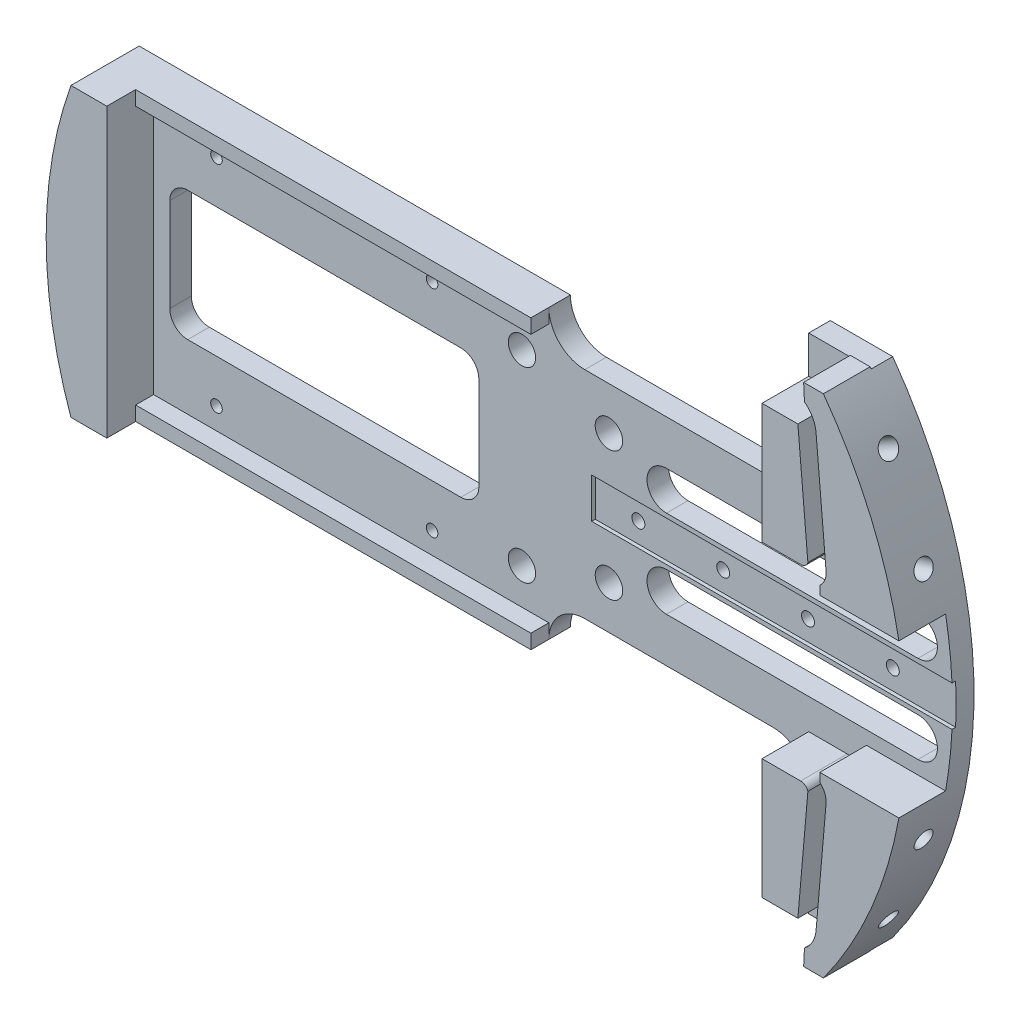
from build123d import *

# Parameters (mm, degrees)
BOSS_EXTRUDE1_DEPTH     = 3.81
BOSS_EXTRUDE2_DEPTH     = 8.255
SKETCH3_W               = 64.77
SKETCH3_H               = 7.1
CUT_EXTRUDE1_DEPTH      = 0.635
CUT_EXTRUDE4_DEPTH      = 89.512075769
CUT_EXTRUDE5_DEPTH      = 89.512075769
SKETCH12_R              = 2.4257
CUT_EXTRUDE6_DEPTH      = 89.512075769
SKETCH4_R               = 1.143
CUT_EXTRUDE2_DEPTH      = 11.43
SKETCH17_R              = 2.413
CUT_EXTRUDE9_DEPTH      = 89.512075769
BOSS_EXTRUDE5_DEPTH     = 8.255
SKETCH20_W              = 69.85
SKETCH20_H              = 3.175
BOSS_EXTRUDE6_DEPTH     = 2.54
SKETCH21_R              = 1.02235
CUT_EXTRUDE10_DEPTH     = 89.948337573
SKETCH24_R              = 1.6383
CUT_EXTRUDE11_DEPTH     = 8.128
CIRPATTERN1_COUNT       = 2
CIRPATTERN1_ANGLE       = 12.5
MIRROR2_COPY_1_SKETCH_R = 1.6383
MIRROR2_COPY_1_DEPTH    = 8.128
MIRROR2_COPY_2_SKETCH_R = 1.6383
MIRROR2_COPY_2_DEPTH    = 8.128


with BuildPart() as part:
    # Sketch1 → Boss-Extrude1 (new body)
    with BuildSketch(Plane.XY):
        with BuildLine():
            Line((10.977415053, 19.05), (44.196, 19.05))
            ThreePointArc((44.196, 19.05), (48.686128061, 20.909871939), (50.546, 25.4))
            Line((50.546, 25.4), (50.546, 44.45))
            Line((50.546, 44.45), (61.579155694, 44.45))
            ThreePointArc((61.579155694, 44.45), (75.946, 0), (61.579155694, -44.45))
            Line((61.579155694, -44.45), (50.546, -44.45))
            Line((50.546, -44.45), (50.546, -25.4))
            ThreePointArc((50.546, -25.4), (48.686128061, -20.909871939), (44.196, -19.05))
            Line((44.196, -19.05), (10.977415053, -19.05))
            ThreePointArc((10.977415053, -19.05), (6.487286992, -20.909871939), (4.627415053, -25.4))
            Line((4.627415053, -25.4), (-71.572584947, -25.4))
            ThreePointArc((-71.572584947, -25.4), (-75.946, 0), (-71.572584947, 25.4))
            Line((-71.572584947, 25.4), (4.627415053, 25.4))
            ThreePointArc((4.627415053, 25.4), (6.487286992, 20.909871939), (10.977415053, 19.05))
        make_face()
    extrude(amount=BOSS_EXTRUDE1_DEPTH)

    # Sketch2 → Boss-Extrude2 (add)
    with BuildSketch(Plane.XY.offset(3.81)):
        with BuildLine():
            Line((61.865268471, 17.78), (60.095110466, 38.1))
            ThreePointArc((60.095110466, 38.1), (59.464196764, 40.158289632), (58.047089349, 41.778911391))
            Line((58.047089349, 41.778911391), (57.900800643, 44.704))
            Line((57.900800643, 44.704), (61.395010384, 44.704))
            ThreePointArc((61.395010384, 44.704), (69.822038137, 29.877715884), (74.728381149, 13.544887112))
            Line((74.728381149, 13.544887112), (60.759450402, 13.544887112))
            Line((60.759450402, 13.544887112), (60.759450402, 15.094127876))
            ThreePointArc((60.759450402, 15.094127876), (61.639191639, 16.302501703), (61.865268471, 17.78))
        make_face()
        with BuildLine():
            Line((58.651639318, 17.500047669), (56.881481313, 37.820047669))
            Line((56.881481313, 37.820047669), (50.546, 37.820047669))
            Line((50.546, 37.820047669), (50.546, 16.566735288))
            Line((50.546, 16.566735288), (57.366094516, 16.566735288))
            ThreePointArc((57.366094516, 16.566735288), (58.160401987, 16.824667019), (58.651639318, 17.500047669))
        make_face()
        with BuildLine():
            Line((60.759450402, -13.544887112), (74.728381149, -13.544887112))
            ThreePointArc((74.728381149, -13.544887112), (69.822038137, -29.877715884), (61.395010384, -44.704))
            Line((61.395010384, -44.704), (57.900800643, -44.704))
            Line((57.900800643, -44.704), (58.047089349, -41.778911391))
            ThreePointArc((58.047089349, -41.778911391), (59.464196764, -40.158289632), (60.095110466, -38.1))
            Line((60.095110466, -38.1), (61.865268471, -17.78))
            ThreePointArc((61.865268471, -17.78), (61.639191639, -16.302501703), (60.759450402, -15.094127876))
            Line((60.759450402, -15.094127876), (60.759450402, -13.544887112))
        make_face()
        with BuildLine():
            Line((50.546, -16.566735288), (57.366094516, -16.566735288))
            ThreePointArc((57.366094516, -16.566735288), (58.160401987, -16.824667019), (58.651639318, -17.500047669))
            Line((58.651639318, -17.500047669), (56.881481313, -37.820047669))
            Line((56.881481313, -37.820047669), (50.546, -37.820047669))
            Line((50.546, -37.820047669), (50.546, -16.566735288))
        make_face()
    extrude(amount=BOSS_EXTRUDE2_DEPTH)

    # Sketch3 → Cut-Extrude1 (cut)
    with BuildSketch(Plane.XY.offset(3.81)):
        with Locations((44.577, 0)):
            Rectangle(SKETCH3_W, SKETCH3_H)
    extrude(amount=-CUT_EXTRUDE1_DEPTH, mode=Mode.SUBTRACT)

    # Sketch9 → Cut-Extrude4 (cut, through all)
    with BuildSketch(Plane.XY.offset(3.81)):
        with BuildLine():
            Line((69.85, 11.17), (25.4, 11.17))
            ThreePointArc((25.4, 11.17), (21.971, 7.741), (25.4, 4.312))
            Line((25.4, 4.312), (69.85, 4.312))
            ThreePointArc((69.85, 4.312), (73.279, 7.741), (69.85, 11.17))
        make_face()
        with BuildLine():
            Line((69.85, -4.312), (25.4, -4.312))
            ThreePointArc((25.4, -4.312), (21.971, -7.741), (25.4, -11.17))
            Line((25.4, -11.17), (69.85, -11.17))
            ThreePointArc((69.85, -11.17), (73.279, -7.741), (69.85, -4.312))
        make_face()
    extrude(amount=-CUT_EXTRUDE4_DEPTH, mode=Mode.SUBTRACT)

    # Sketch10 → Cut-Extrude5 (cut, through all)
    with BuildSketch(Plane.XY.offset(3.81)):
        with BuildLine():
            Line((-10.922, 11.43), (-59.182, 11.43))
            ThreePointArc((-59.182, 11.43), (-61.42706403, 10.50006403), (-62.357, 8.255))
            Line((-62.357, 8.255), (-62.357, -8.255))
            ThreePointArc((-62.357, -8.255), (-61.42706403, -10.50006403), (-59.182, -11.43))
            Line((-59.182, -11.43), (-10.922, -11.43))
            ThreePointArc((-10.922, -11.43), (-8.67693597, -10.50006403), (-7.747, -8.255))
            Line((-7.747, -8.255), (-7.747, 8.255))
            ThreePointArc((-7.747, 8.255), (-8.67693597, 10.50006403), (-10.922, 11.43))
        make_face()
    extrude(amount=-CUT_EXTRUDE5_DEPTH, mode=Mode.SUBTRACT)

    # Sketch12 → Cut-Extrude6 (cut, through all)
    with BuildSketch(Plane.XY.offset(3.81)):
        with Locations((15.24, 11.43)):
            Circle(SKETCH12_R)
        with Locations((15.24, -11.43)):
            Circle(SKETCH12_R)
    extrude(amount=-CUT_EXTRUDE6_DEPTH, mode=Mode.SUBTRACT)

    # Sketch4 → Cut-Extrude2 (cut)
    with BuildSketch(Plane.XY.offset(3.175)):
        with Locations((19.812, 0)):
            Circle(SKETCH4_R)
        with Locations((34.798, 0)):
            Circle(SKETCH4_R)
        with Locations((49.784, 0)):
            Circle(SKETCH4_R)
        with Locations((64.77, 0)):
            Circle(SKETCH4_R)
    extrude(amount=-CUT_EXTRUDE2_DEPTH, mode=Mode.SUBTRACT)

    # Sketch17 → Cut-Extrude9 (cut, through all)
    with BuildSketch(Plane.XY.offset(3.81)):
        with Locations((-0.127, 16.51)):
            Circle(SKETCH17_R)
        with Locations((-0.127, -16.51)):
            Circle(SKETCH17_R)
    extrude(amount=-CUT_EXTRUDE9_DEPTH, mode=Mode.SUBTRACT)

    # Sketch19 → Boss-Extrude5 (add)
    with BuildSketch(Plane.XY.offset(3.81)):
        with BuildLine():
            Line((-71.572584947, -25.4), (-65.222584947, -25.4))
            Line((-65.222584947, -25.4), (-65.222584947, 25.4))
            Line((-65.222584947, 25.4), (-71.572584947, 25.4))
            ThreePointArc((-71.572584947, 25.4), (-75.946, 0), (-71.572584947, -25.4))
        make_face()
    extrude(amount=BOSS_EXTRUDE5_DEPTH)

    # Sketch20 → Boss-Extrude6 (add)
    with BuildSketch(Plane.XZ.offset(25.4)):
        with Locations((-30.297584947, 5.3975)):
            Rectangle(SKETCH20_W, SKETCH20_H)
    boss_extrude6 = extrude(amount=-BOSS_EXTRUDE6_DEPTH)

    # Mirror1: Boss-Extrude6 across plane
    add(boss_extrude6.mirror(Plane.ZX))

    # Sketch21 → Cut-Extrude10 (cut, through all)
    with BuildSketch(Plane(origin=(0, 0, 0), x_dir=(-1, 0, 0), z_dir=(0, 0, -1))):
        with Locations((54.102, 19.05)):
            Circle(SKETCH21_R)
        with Locations((16.002, 19.05)):
            Circle(SKETCH21_R)
        with Locations((16.002, -19.05)):
            Circle(SKETCH21_R)
        with Locations((54.102, -19.05)):
            Circle(SKETCH21_R)
    extrude(amount=-CUT_EXTRUDE10_DEPTH, mode=Mode.SUBTRACT)

    # Sketch24 → Cut-Extrude11 (cut)
    with BuildSketch(Plane(origin=(65.771165316, 37.973, 0), x_dir=(0, 0, -1), z_dir=(0.866025403784438, 0.5000000000000012, 0))):
        with Locations((-6.0325, -2.224428615)):
            Circle(SKETCH24_R)
    cut_extrude11 = extrude(amount=-CUT_EXTRUDE11_DEPTH, mode=Mode.SUBTRACT)

    # CirPattern1: Cut-Extrude11 ×2 about axis
    cirpattern1_axis = Axis((0, 0, 3.81), (0, 0, -1))
    for i in range(1, CIRPATTERN1_COUNT):
        add(cut_extrude11.rotate(cirpattern1_axis, i * CIRPATTERN1_ANGLE / (CIRPATTERN1_COUNT - 1)), mode=Mode.SUBTRACT)

    # Mirror2 copy 1 sketch → Mirror2 copy 1 (cut)
    with BuildSketch(Plane(origin=(72.430987542, -22.837402649, 0), x_dir=(0, 0, -1), z_dir=(0.9537169507482268, -0.30070579950427395, 0))):
        with Locations((-6.0325, 2.224428615)):
            Circle(MIRROR2_COPY_1_SKETCH_R)
    extrude(amount=-MIRROR2_COPY_1_DEPTH, mode=Mode.SUBTRACT)

    # Mirror2 copy 2 sketch → Mirror2 copy 2 (cut)
    with BuildSketch(Plane(origin=(65.771165316, -37.973, 0), x_dir=(0, 0, -1), z_dir=(0.866025403784438, -0.5000000000000012, 0))):
        with Locations((-6.0325, 2.224428615)):
            Circle(MIRROR2_COPY_2_SKETCH_R)
    extrude(amount=-MIRROR2_COPY_2_DEPTH, mode=Mode.SUBTRACT)


solid = part.part
